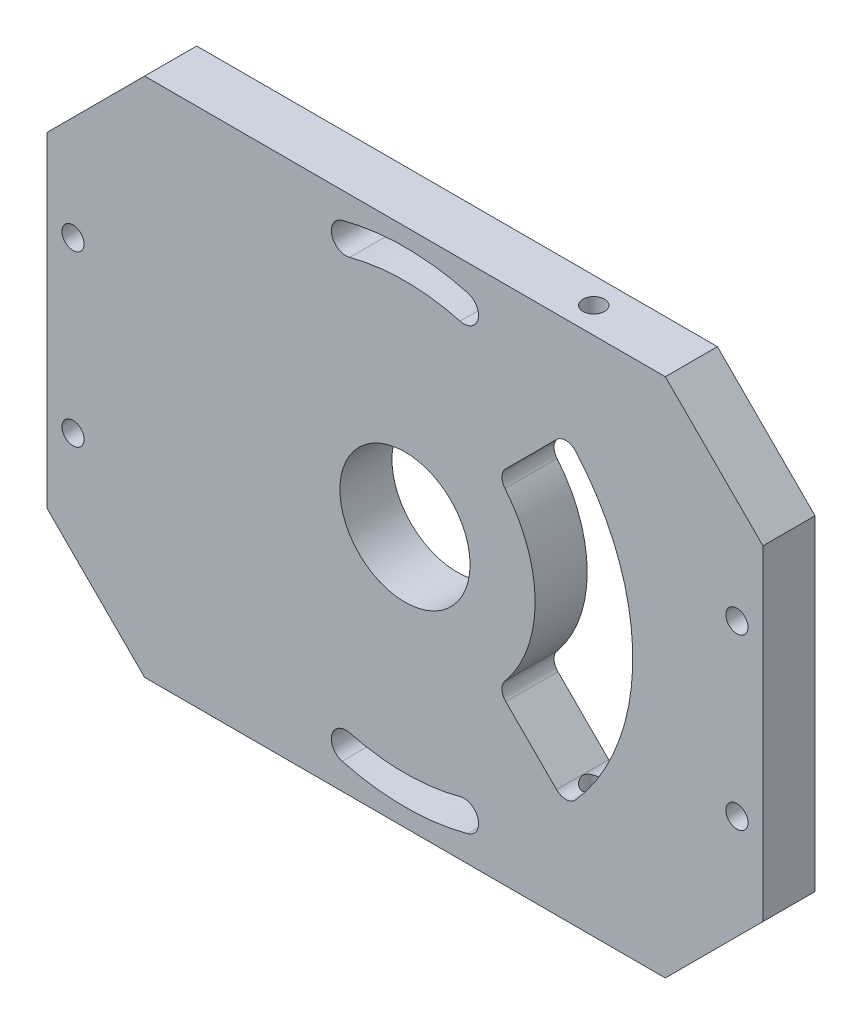
from build123d import *

# Parameters (mm, degrees)
SKETCH_1_W                   = 80
SKETCH_1_H                   = 14.999999944
SKETCH_1_H_2                 = 50
SKETCH_1_W_2                 = 14.999999944
SKETCH_1_W_3                 = 15.000000056
EXTRUDE_1_DEPTH              = 8
AXISHOLE_REACH               = 70.476
SKETCH_2_R                   = 10
LOCKINGSLOT_REACH            = 70.476
ADJUSTSLOT_REACH             = 70.476
FILLET_1_R                   = 2
HOLE_START                   = -39.999999944
HOLE_WIZARD_M4_1_OUTLINE_R   = 1.65
HOLE_WIZARD_M4_1_DEPTH       = 16.797680198
HOLE_WIZARD_M3_1_D           = 3.4
HOLE_WIZARD_M3_1_CSINK_D     = 6.72
HOLE_WIZARD_M3_1_CSINK_ANGLE = 90


# Read off the part's stored shape, not the designer's step: M4 나사 구멍1
with BuildPart() as part:
    # 스케치1 → 보스-돌출1 (new body)
    with BuildSketch(Plane.XY):
        with Locations((-5.6e-08, -32.499999972)):
            Rectangle(SKETCH_1_W, SKETCH_1_H)
        with Locations((-5.6e-08, 0)):
            Rectangle(SKETCH_1_W, SKETCH_1_H_2)
        Polygon((39.999999944, 39.999999832), (-40.000000056, 40.000000056), (-40.000000056, 25), (39.999999944, 25), align=None)
        with Locations((47.499999916, 0)):
            Rectangle(SKETCH_1_W_2, SKETCH_1_H_2)
        with Locations((-47.500000084, 0)):
            Rectangle(SKETCH_1_W_3, SKETCH_1_H_2)
        Polygon((-40.000000056, -25), (-55.000000112, -25), (-40.000000056, -39.999999944), align=None)
        Polygon((54.999999888, -25), (39.999999944, -25), (39.999999944, -39.999999944), align=None)
        Polygon((54.999999888, 25), (39.999999944, 39.999999832), (39.999999944, 25), align=None)
        Polygon((-40.000000056, 25), (-40.000000056, 40.000000056), (-55.000000112, 25), align=None)
    extrude(amount=EXTRUDE_1_DEPTH)

    # 스케치2 → AXISHOLE (cut, up to next)
    with BuildSketch(Plane.XY.offset(8), mode=Mode.PRIVATE) as axishole_sk1:
        Circle(SKETCH_2_R)
    axishole_tool1 = extrude(axishole_sk1.sketch, amount=-AXISHOLE_REACH, mode=Mode.PRIVATE) & part.part
    add(axishole_tool1.solids().sort_by_distance((0, 0, 8))[0], mode=Mode.SUBTRACT)

    # 스케치3 → LOCKINGSLOT (cut, up to next)
    with BuildSketch(Plane.XY.offset(8), mode=Mode.PRIVATE) as lockingslot_sk1:
        with BuildLine():
            ThreePointArc((-9.64100943, -35.980737029), (0, -37.25), (9.64100943, -35.980737029))
            ThreePointArc((9.64100943, -35.980737029), (11.231999688, -33.225061069), (8.476323727, -31.634070811))
            ThreePointArc((8.476323727, -31.634070811), (0, -32.75), (-8.476323727, -31.634070811))
            ThreePointArc((-8.476323727, -31.634070811), (-11.231999688, -33.225061069), (-9.64100943, -35.980737029))
        make_face()
    lockingslot_tool1 = extrude(lockingslot_sk1.sketch, amount=-LOCKINGSLOT_REACH, mode=Mode.PRIVATE) & part.part
    # 스케치3 → LOCKINGSLOT (cut, up to next)
    with BuildSketch(Plane.XY.offset(8), mode=Mode.PRIVATE) as lockingslot_sk2:
        with BuildLine():
            ThreePointArc((9.64100943, 35.980737029), (0, 37.25), (-9.64100943, 35.980737029))
            ThreePointArc((-9.64100943, 35.980737029), (-11.231999688, 33.225061069), (-8.476323727, 31.634070811))
            ThreePointArc((-8.476323727, 31.634070811), (0, 32.75), (8.476323727, 31.634070811))
            ThreePointArc((8.476323727, 31.634070811), (11.231999688, 33.225061069), (9.64100943, 35.980737029))
        make_face()
    lockingslot_tool2 = extrude(lockingslot_sk2.sketch, amount=-LOCKINGSLOT_REACH, mode=Mode.PRIVATE) & part.part
    add(lockingslot_tool1.solids().sort_by_distance((0, -34.473161, 8))[0], mode=Mode.SUBTRACT)
    add(lockingslot_tool2.solids().sort_by_distance((0, 34.473161, 8))[0], mode=Mode.SUBTRACT)

    # 스케치4 → ADJUSTSLOT (cut, up to next)
    with BuildSketch(Plane.XY.offset(8), mode=Mode.PRIVATE) as adjustslot_sk1:
        with BuildLine():
            Line((24.748737262, 24.748737262), (14.142135545, 14.142135545))
            ThreePointArc((14.142135545, 14.142135545), (19.999999888, 0), (14.142135545, -14.142135545))
            Line((14.142135545, -14.142135545), (24.748737262, -24.748737262))
            ThreePointArc((24.748737262, -24.748737262), (34.999999888, 0), (24.748737262, 24.748737262))
        make_face()
    adjustslot_tool1 = extrude(adjustslot_sk1.sketch, amount=-ADJUSTSLOT_REACH, mode=Mode.PRIVATE) & part.part
    add(adjustslot_tool1.solids().sort_by_distance((25.372551, 0, 8))[0], mode=Mode.SUBTRACT)

    # 필렛1
    fillet_1_edges = [part.edges().sort_by_distance(p)[0] for p in [
        (24.748737262, 24.748737262, 4),
        (24.748737262, -24.748737262, 4),
        (14.142135545, -14.142135545, 4),
        (14.142135545, 14.142135545, 4),
    ]]
    fillet(fillet_1_edges, radius=FILLET_1_R)

    # M4 나사 구멍1 outline → M4 나사 구멍1 (cut)
    with BuildSketch(Plane(origin=(0, 0, 0), x_dir=(1, 0, 0), z_dir=(0, 1, 0)).offset(HOLE_START)):
        with Locations((24.999999888, -4)):
            Circle(HOLE_WIZARD_M4_1_OUTLINE_R)
    hole_wizard_m4_1 = extrude(amount=HOLE_WIZARD_M4_1_DEPTH, mode=Mode.SUBTRACT)

    # 대칭 복사1: M4 나사 구멍1 across plane
    add(hole_wizard_m4_1.mirror(Plane(origin=(0, 0, 0), x_dir=(0, 0, 1), z_dir=(-1.3990850145084723e-09, -1.0, 0))), mode=Mode.SUBTRACT)

    # M3 육각 소켓 접시 머리 캡 나사용 카운터싱크1 (through all)
    with Locations(Plane(origin=(0, 0, 0), x_dir=(-1, 0, 0), z_dir=(0, 0, -1))):
        with Locations((51.000000112, -13), (51.000000112, 13), (-51.000000112, -13), (-51.000000112, 13)):
            CounterSinkHole(HOLE_WIZARD_M3_1_D / 2, HOLE_WIZARD_M3_1_CSINK_D / 2, counter_sink_angle=HOLE_WIZARD_M3_1_CSINK_ANGLE)


solid = part.part
